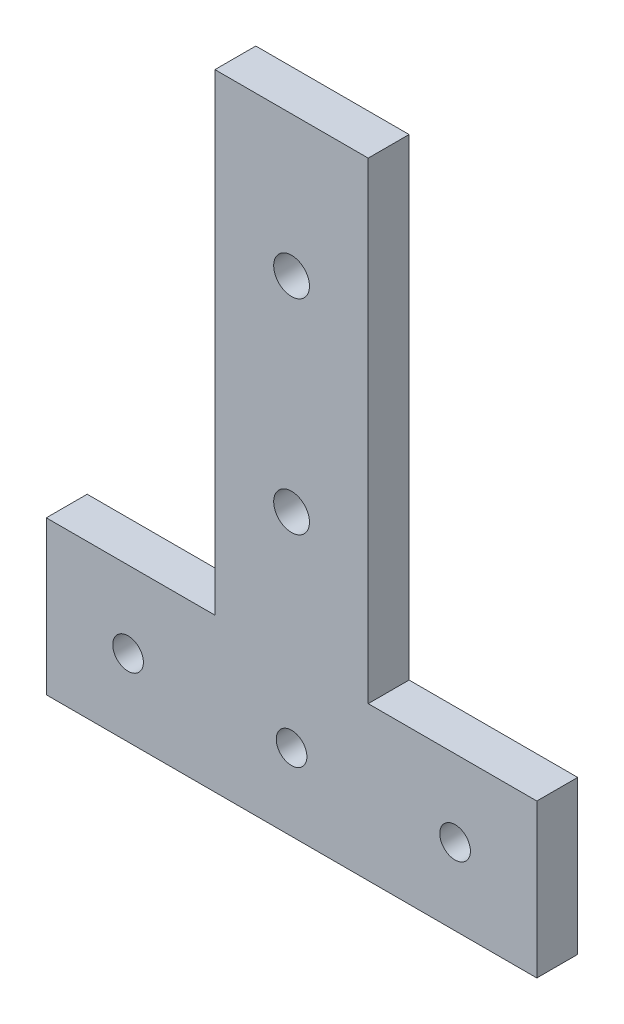
from build123d import *

# Parameters (mm, degrees)
SKETCH_1_R      = 1.5
SKETCH_1_R_2    = 1.75
EXTRUDE_1_DEPTH = 4


with BuildPart() as part:
    # 草图1 → 凸台-拉伸1 (new body)
    with BuildSketch(Plane.XY):
        Polygon((24, 7.5), (7.5, 7.5), (7.5, 53.732798972), (-7.5, 53.732798972), (-7.5, 7.5), (-24, 7.5), (-24, -7.5), (24, -7.5), align=None)
        with Locations((-16, 0)):
            Circle(SKETCH_1_R, mode=Mode.SUBTRACT)
        Circle(SKETCH_1_R, mode=Mode.SUBTRACT)
        with Locations((0, 20)):
            Circle(SKETCH_1_R_2, mode=Mode.SUBTRACT)
        with Locations((16, 0)):
            Circle(SKETCH_1_R, mode=Mode.SUBTRACT)
        with Locations((0, 40)):
            Circle(SKETCH_1_R_2, mode=Mode.SUBTRACT)
    extrude(amount=EXTRUDE_1_DEPTH)


solid = part.part
